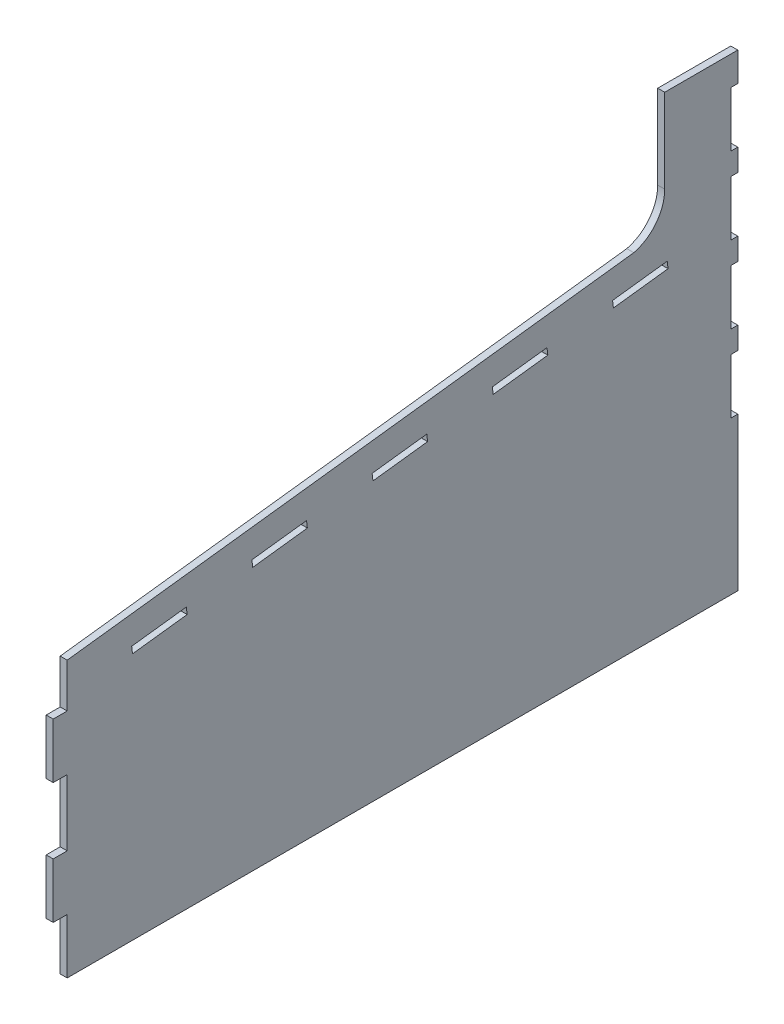
from build123d import *

# Parameters (mm, degrees)
BOSS_EXTRUDE1_DEPTH = 6.35
CUT_EXTRUDE1_DEPTH  = 6.35


with BuildPart() as part:
    # Sketch1 → Boss-Extrude1 (new body)
    with BuildSketch(Plane(origin=(0, 0, 0), x_dir=(0, 0, -1), z_dir=(1, 0, 0))):
        with BuildLine():
            Line((0, 250), (514.569488044, 313.181188643))
            ThreePointArc((514.569488044, 313.181188643), (534.796363904, 326.297688332), (542.65, 349.09))
            Line((542.65, 349.09), (542.65, 425.32))
            Line((542.65, 425.32), (609, 425.32))
            Line((609, 425.32), (609, 398.97))
            Line((609, 398.97), (602.65, 398.97))
            Line((602.65, 398.97), (602.65, 348.97))
            Line((602.65, 348.97), (609, 348.97))
            Line((609, 348.97), (609, 328.97))
            Line((609, 328.97), (602.65, 328.97))
            Line((602.65, 328.97), (602.65, 278.97))
            Line((602.65, 278.97), (609, 278.97))
            Line((609, 278.97), (609, 258.97))
            Line((609, 258.97), (602.65, 258.97))
            Line((602.65, 258.97), (602.65, 208.97))
            Line((602.65, 208.97), (609, 208.97))
            Line((609, 208.97), (609, 188.97))
            Line((609, 188.97), (602.65, 188.97))
            Line((602.65, 188.97), (602.65, 138.97))
            Line((602.65, 138.97), (609, 138.97))
            Line((609, 138.97), (609, 0))
            Line((609, 0), (0, 0))
            Line((0, 0), (0, 50))
            Line((0, 50), (-12.7, 50))
            Line((-12.7, 50), (-12.7, 100))
            Line((-12.7, 100), (0, 100))
            Line((0, 100), (0, 160))
            Line((0, 160), (-12.7, 160))
            Line((-12.7, 160), (-12.7, 210))
            Line((-12.7, 210), (0, 210))
            Line((0, 210), (0, 250))
        make_face()
    extrude(amount=BOSS_EXTRUDE1_DEPTH)

    # Sketch2 → Cut-Extrude1 (cut)
    with BuildSketch(Plane(origin=(6.35, 0, 0), x_dir=(0, 0, -1), z_dir=(1, 0, 0))):
        Polygon((58.560222947, 231.599541694), (59.334093277, 225.296873631), (108.96140086, 231.390340802), (108.187530529, 237.693008865), align=None)
        Polygon((217.367607209, 251.098636639), (167.740299627, 245.005169469), (168.514169958, 238.702501406), (218.14147754, 244.795968576), align=None)
        Polygon((326.54768389, 264.504264414), (276.920376308, 258.410797243), (277.694246639, 252.10812918), (327.321554221, 258.201596351), align=None)
        Polygon((435.727760571, 277.909892188), (386.100452988, 271.816425018), (386.874323319, 265.513756955), (436.501630901, 271.607224125), align=None)
        Polygon((544.907837251, 291.315519963), (495.280529669, 285.222052793), (496.0544, 278.91938473), (545.681707582, 285.0128519), align=None)
    extrude(amount=-CUT_EXTRUDE1_DEPTH, mode=Mode.SUBTRACT)


solid = part.part
